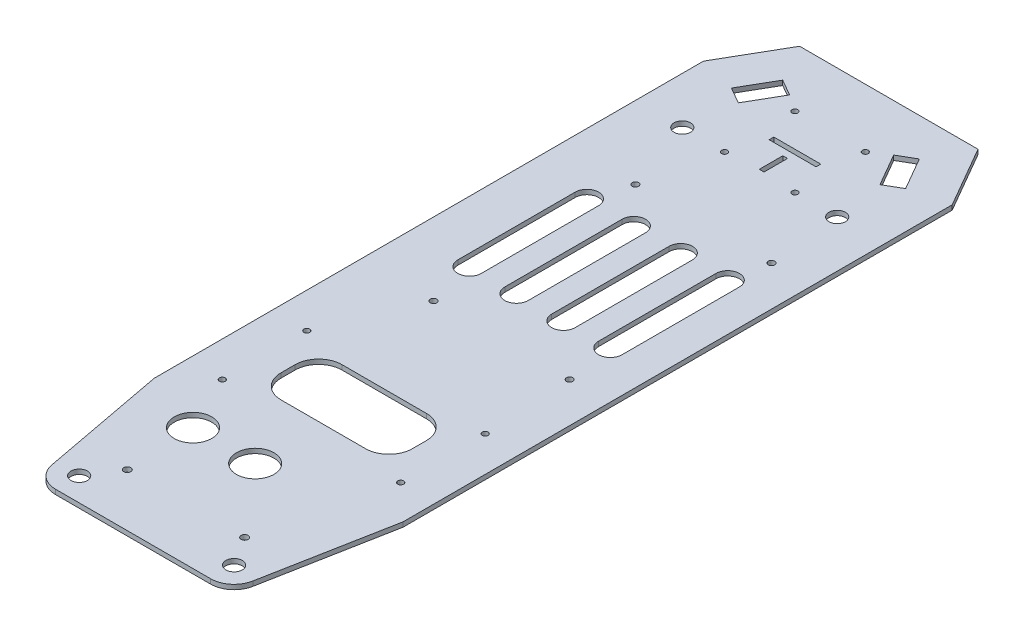
from build123d import *

# Parameters (mm, degrees)
ESQUISSE1_W              = 106
ESQUISSE1_H              = 332
ESQUISSE1_R              = 3.5
BOSS_EXTRU_1_DEPTH       = 2
ESQUISSE3_R              = 1.375
ENL_V_MAT_EXTRU_1_DEPTH  = 192.01112533
CHANFREIN1_SIZE          = 15
CHANFREIN1_SIZE2         = 25.980762114
ESQUISSE4_R              = 1.25
ESQUISSE4_W              = 56
ESQUISSE4_H              = 26
ENL_V_MAT_EXTRU_2_DEPTH  = 10
CONG_1_R                 = 10
ESQUISSE6_R              = 1.25
ESQUISSE6_W              = 20
ESQUISSE6_H              = 2
ESQUISSE6_W_2            = 2
ESQUISSE6_H_2            = 10
ENL_V_MAT_EXTRU_4_DEPTH  = 10
ESQUISSE7_R              = 8
ENL_V_MAT_EXTRU_5_DEPTH  = 10
ESQUISSE8_OUTSIDE_W      = 177.704
ESQUISSE8_OUTSIDE_H      = 403.704
ENL_V_MAT_EXTRU_6_DEPTH  = 10
ENL_V_MAT_EXTRU_8_DEPTH  = 10
ESQUISSE11_R             = 1.5
ENL_V_MAT_EXTRU_9_DEPTH  = 10
ENL_V_MAT_EXTRU_10_DEPTH = 10


with BuildPart() as part:
    # Esquisse1 → Boss.-Extru.1 (new body)
    with BuildSketch(Plane(origin=(0, 0, 0), x_dir=(1, 0, 0), z_dir=(0, 1, 0))):
        with Locations((0, 17.5)):
            Rectangle(ESQUISSE1_W, ESQUISSE1_H)
        with Locations((-33, 128.5)):
            Circle(ESQUISSE1_R, mode=Mode.SUBTRACT)
        with Locations((-33, -128.5)):
            Circle(ESQUISSE1_R, mode=Mode.SUBTRACT)
        with Locations((33, 128.5)):
            Circle(ESQUISSE1_R, mode=Mode.SUBTRACT)
        with Locations((33, -128.5)):
            Circle(ESQUISSE1_R, mode=Mode.SUBTRACT)
    extrude(amount=BOSS_EXTRU_1_DEPTH)

    # Esquisse3 → Enlèv. mat.-Extru.1 (cut, through all)
    with BuildSketch(Plane(origin=(0, 2, 0), x_dir=(1, 0, 0), z_dir=(0, 1, 0))):
        with Locations((-22, 11.5)):
            Circle(ESQUISSE3_R)
        with Locations((-22, 97.5)):
            Circle(ESQUISSE3_R)
        with Locations((36, 97.5)):
            Circle(ESQUISSE3_R)
        with Locations((36, 11.5)):
            Circle(ESQUISSE3_R)
    extrude(amount=-ENL_V_MAT_EXTRU_1_DEPTH, mode=Mode.SUBTRACT)

    # Chanfrein1
    chanfrein1_edges = [part.edges().sort_by_distance(p)[0] for p in [
        (-53, 1, -183.5),
        (53, 1, -183.5),
    ]]
    chanfrein1_side = [part.faces().sort_by_distance(p)[0] for p in [
        (0, 1, -183.5),
    ]]
    chamfer(chanfrein1_edges, length=CHANFREIN1_SIZE, length2=CHANFREIN1_SIZE2, reference=chanfrein1_side[0])

    # Esquisse4 → Enlèv. mat.-Extru.2 (cut)
    with BuildSketch(Plane(origin=(0, 2, 0), x_dir=(1, 0, 0), z_dir=(0, 1, 0))):
        with Locations((38, -62.5)):
            Circle(ESQUISSE4_R)
        with Locations((38, -26.5)):
            Circle(ESQUISSE4_R)
        with Locations((-38, -62.5)):
            Circle(ESQUISSE4_R)
        with Locations((-38, -26.5)):
            Circle(ESQUISSE4_R)
        with Locations((0, -44.5)):
            Rectangle(ESQUISSE4_W, ESQUISSE4_H)
    extrude(amount=-ENL_V_MAT_EXTRU_2_DEPTH, mode=Mode.SUBTRACT)

    # Congé1
    cong_1_edges = [part.edges().sort_by_distance(p)[0] for p in [
        (28, 1, 57.5),
        (28, 1, 31.5),
        (-28, 1, 31.5),
        (-28, 1, 57.5),
    ]]
    fillet(cong_1_edges, radius=CONG_1_R)

    # Esquisse6 → Enlèv. mat.-Extru.4 (cut)
    with BuildSketch(Plane(origin=(0, 2, 0), x_dir=(1, 0, 0), z_dir=(0, 1, 0))):
        with Locations((-15, 128.5)):
            Circle(ESQUISSE6_R)
        with Locations((15, 128.5)):
            Circle(ESQUISSE6_R)
        with Locations((-15, 158.5)):
            Circle(ESQUISSE6_R)
        with Locations((15, 158.5)):
            Circle(ESQUISSE6_R)
        with Locations((0, 143.5)):
            Rectangle(ESQUISSE6_W, ESQUISSE6_H)
        with Locations((-0.179881847, 134.5)):
            Rectangle(ESQUISSE6_W_2, ESQUISSE6_H_2)
    extrude(amount=-ENL_V_MAT_EXTRU_4_DEPTH, mode=Mode.SUBTRACT)

    # Esquisse7 → Enlèv. mat.-Extru.5 (cut)
    with BuildSketch(Plane(origin=(0, 2, 0), x_dir=(1, 0, 0), z_dir=(0, 1, 0))):
        with Locations((0, -86.5)):
            Circle(ESQUISSE7_R)
        with Locations((-26.5, -86.5)):
            Circle(ESQUISSE7_R)
    extrude(amount=-ENL_V_MAT_EXTRU_5_DEPTH, mode=Mode.SUBTRACT)

    # Esquisse8 outside → Enlèv. mat.-Extru.6 (cut)
    with BuildSketch(Plane(origin=(0, 2, 0), x_dir=(1, 0, 0), z_dir=(0, 1, 0))):
        with Locations((0, 17.5)):
            Rectangle(ESQUISSE8_OUTSIDE_W, ESQUISSE8_OUTSIDE_H)
        with BuildLine():
            Line((38, 183.5), (-38, 183.5))
            Line((-38, 183.5), (-53, 157.519237886))
            Line((-53, 157.519237886), (-53, -76.5))
            Line((-53, -76.5), (-42.82620953, -130.356234435))
            ThreePointArc((-42.82620953, -130.356234435), (-39.381130607, -136.199426743), (-33, -138.5))
            Line((-33, -138.5), (33, -138.5))
            ThreePointArc((33, -138.5), (39.381130607, -136.199426743), (42.82620953, -130.356234435))
            Line((42.82620953, -130.356234435), (53, -76.5))
            Line((53, -76.5), (53, 157.519237886))
            Line((53, 157.519237886), (38, 183.5))
        make_face(mode=Mode.SUBTRACT)
    extrude(amount=-ENL_V_MAT_EXTRU_6_DEPTH, mode=Mode.SUBTRACT)

    # Esquisse10 → Enlèv. mat.-Extru.8 (cut)
    with BuildSketch(Plane.XZ):
        Polygon((32.563466521, -150.916352203), (30.18189666, -149.541352203), (26.186846942, -156.460981293), (22.18189666, -163.397758664), (24.563466521, -164.772758664), (29.11009989, -167.397758664), (37.11009989, -153.541352203), align=None)
        Polygon((-24.563466521, -164.772758664), (-22.18189666, -163.397758664), (-26.186846942, -156.460981293), (-30.18189666, -149.541352203), (-32.563466521, -150.916352203), (-37.11009989, -153.541352203), (-29.11009989, -167.397758664), align=None)
    extrude(amount=-ENL_V_MAT_EXTRU_8_DEPTH, mode=Mode.SUBTRACT)

    # Esquisse11 → Enlèv. mat.-Extru.9 (cut)
    with BuildSketch(Plane.XZ):
        with Locations((25, 116)):
            Circle(ESQUISSE11_R)
        with Locations((-25, 116)):
            Circle(ESQUISSE11_R)
    extrude(amount=-ENL_V_MAT_EXTRU_9_DEPTH, mode=Mode.SUBTRACT)

    # Esquisse12 → Enlèv. mat.-Extru.10 (cut)
    with BuildSketch(Plane.XZ):
        with BuildLine():
            Line((38, -31.843333074), (38, -81.843333074))
            ThreePointArc((38, -81.843333074), (33, -86.843333074), (28, -81.843333074))
            Line((28, -81.843333074), (28, -31.843333074))
            ThreePointArc((28, -31.843333074), (33, -26.843333074), (38, -31.843333074))
        make_face()
        with BuildLine():
            Line((18, -31.843333074), (18, -81.843333074))
            ThreePointArc((18, -81.843333074), (13, -86.843333074), (8, -81.843333074))
            Line((8, -81.843333074), (8, -31.843333074))
            ThreePointArc((8, -31.843333074), (13, -26.843333074), (18, -31.843333074))
        make_face()
        with BuildLine():
            Line((-2, -31.843333074), (-2, -81.843333074))
            ThreePointArc((-2, -81.843333074), (-7, -86.843333074), (-12, -81.843333074))
            Line((-12, -81.843333074), (-12, -31.843333074))
            ThreePointArc((-12, -31.843333074), (-7, -26.843333074), (-2, -31.843333074))
        make_face()
        with BuildLine():
            Line((-22, -31.843333074), (-22, -81.843333074))
            ThreePointArc((-22, -81.843333074), (-27, -86.843333074), (-32, -81.843333074))
            Line((-32, -81.843333074), (-32, -31.843333074))
            ThreePointArc((-32, -31.843333074), (-27, -26.843333074), (-22, -31.843333074))
        make_face()
    extrude(amount=-ENL_V_MAT_EXTRU_10_DEPTH, mode=Mode.SUBTRACT)


solid = part.part
